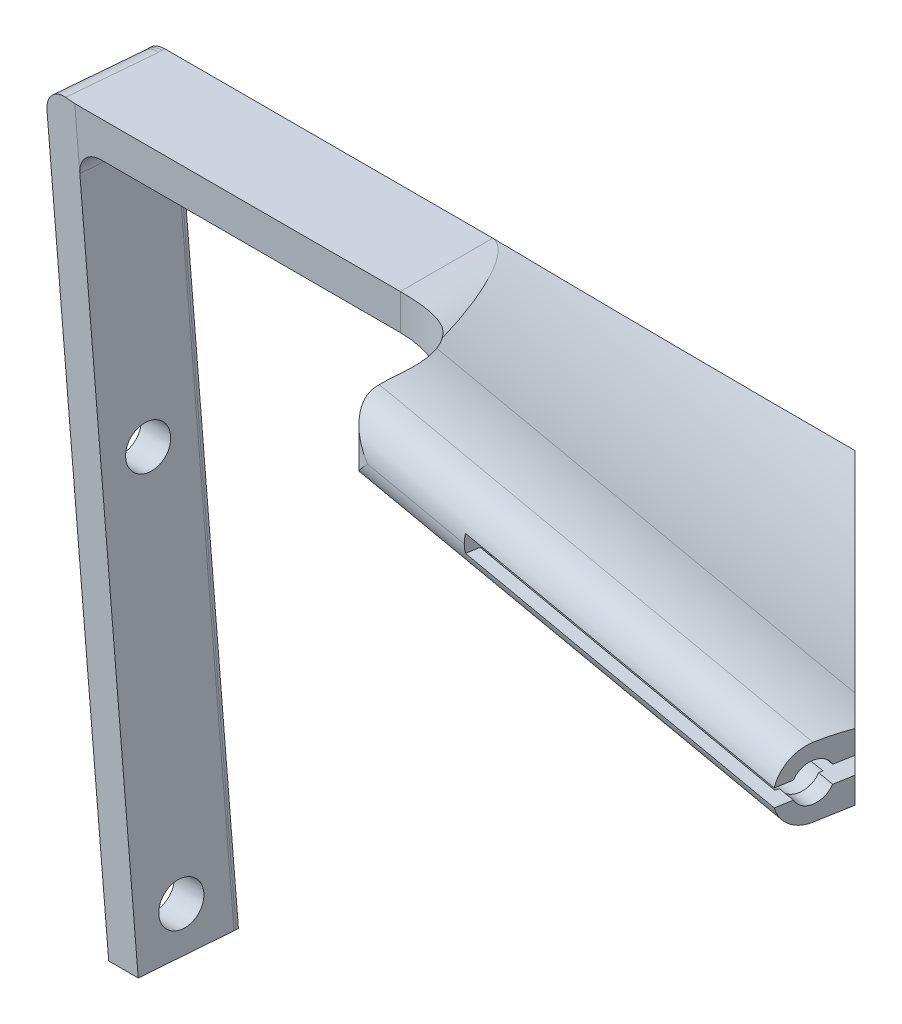
from build123d import *

# Parameters (mm, degrees)
OVERALLGEOMETRY_BOSS_EXTRUDE1_DEPTH = 0.254
CAMERAPITCH_BOSS_EXTRUDE2_DEPTH     = 56.109378
BOSS_EXTRUDE3_DEPTH                 = 5.08
SKETCH3_R                           = 1.524
CUT_EXTRUDE1_DEPTH                  = 97.064287471
CUT_EXTRUDE2_DEPTH                  = 27.94
BOSS_EXTRUDE4_DEPTH                 = 1.27
CUT_EXTRUDE4_DEPTH                  = 95.187753464
CUT_EXTRUDE5_DEPTH                  = 98.850191818
FILLET1_R                           = 2.54
FILLET2_R                           = 7.62
SKETCH10_R                          = 51.133924518
CUT_EXTRUDE6_DEPTH                  = 95.075440862
FILLET3_R                           = 2.54
FILLET4_R                           = 17.78
CUT_EXTRUDE8_DEPTH                  = 94.555694116
CUT_EXTRUDE8_DEPTH_BACK             = 94.555694116
FILLET14_R                          = 1.524
FILLET15_R                          = 1.524
FILLET16_R                          = 1.524
FILLET17_R                          = 1.524


with BuildPart() as part:
    # Sketch1 → OverallGeometry-Boss-Extrude1 (new body)
    with BuildSketch(Plane.XY):
        Polygon((0, 0), (76.2, 0), (76.2, -5.08), (2.853610021, -5.08), (7.281121752, -55.686690663), (4.890254477, -55.895864446), align=None)
    extrude(amount=OVERALLGEOMETRY_BOSS_EXTRUDE1_DEPTH)

    # Sketch2 → CameraPitch-Boss-Extrude2 (add)
    with BuildSketch(Plane(origin=(4.890254477, -55.895864446, 0), x_dir=(0.9961946980917449, 0.08715574274766635, 0), z_dir=(0.08715574274766635, -0.9961946980917449, 0))):
        Polygon((2.4, 0.254), (1.828330337, 6.788214146), (-0.553438966, 6.579836333), (0, 0.254), align=None)
    extrude(amount=-CAMERAPITCH_BOSS_EXTRUDE2_DEPTH)

    # Sketch4 → Boss-Extrude3 (add)
    with BuildSketch(Plane.XZ.offset(5.08)):
        Polygon((76.2, 0.254), (71.789336287, 25.268116927), (33.571372988, 18.529258849), (33.571372988, 6.788214146), (-1.988627012, 6.788214146), (-1.419132725, 0.254), (-1.419132725, 0), (76.2, 0), align=None)
    extrude(amount=-BOSS_EXTRUDE3_DEPTH)

    # Sketch3 → Cut-Extrude1 (cut, through all)
    with BuildSketch(Plane(origin=(2.394675351, 0.209506946, 0.210307229), x_dir=(0.1097410378717943, -0.30459177963520256, -0.9461399222025683), z_dir=(0.9924038765061031, 0.08682408883347341, 0.08715574274766112))):
        with Locations(Location((4.583283833, -24.85972329, 0), (0, 0, 17.803073687))):
            Circle(SKETCH3_R)
        with Locations(Location((13.32842777, -51.395850692, 0), (0, 0, 17.803073687))):
            Circle(SKETCH3_R)
    extrude(amount=-CUT_EXTRUDE1_DEPTH, mode=Mode.SUBTRACT)

    # Sketch5 → Cut-Extrude2 (cut)
    with BuildSketch(Plane(origin=(73.94572541, 0, 13.038626498), x_dir=(0.1736481776669353, 0, -0.9848077530122074), z_dir=(0.9848077530122074, 0, 0.1736481776669353))):
        with BuildLine():
            Line((-12.418150031, -1.905), (-11.402150031, -1.905))
            ThreePointArc((-11.402150031, -1.905), (-9.878150031, -0.889), (-8.354150031, -1.905))
            Line((-8.354150031, -1.905), (-4.544150031, -1.905))
            Line((-4.544150031, -1.905), (-4.544150031, -3.175))
            Line((-4.544150031, -3.175), (-8.354150031, -3.175))
            ThreePointArc((-8.354150031, -3.175), (-9.878150031, -4.191), (-11.402150031, -3.175))
            Line((-11.402150031, -3.175), (-12.418150031, -3.175))
            Line((-12.418150031, -3.175), (-12.418150031, -1.905))
        make_face()
    extrude(amount=-CUT_EXTRUDE2_DEPTH, mode=Mode.SUBTRACT)

    # Sketch6 → Boss-Extrude4 (add)
    with BuildSketch(Plane(origin=(73.94572541, 0, 13.038626498), x_dir=(0.1736481776669353, 0, -0.9848077530122074), z_dir=(0.9848077530122074, 0, 0.1736481776669353))):
        with BuildLine():
            Line((-11.402150031, -1.905), (-11.12249082, -1.905))
            ThreePointArc((-11.12249082, -1.905), (-9.878150031, -1.143), (-8.633809242, -1.905))
            Line((-8.633809242, -1.905), (-8.354150031, -1.905))
            ThreePointArc((-8.354150031, -1.905), (-9.878150031, -0.889), (-11.402150031, -1.905))
        make_face()
        with BuildLine():
            Line((-8.354150031, -3.175), (-8.633809242, -3.175))
            ThreePointArc((-8.633809242, -3.175), (-9.878150031, -3.937), (-11.12249082, -3.175))
            Line((-11.12249082, -3.175), (-11.402150031, -3.175))
            ThreePointArc((-11.402150031, -3.175), (-9.878150031, -4.191), (-8.354150031, -3.175))
        make_face()
    extrude(amount=-BOSS_EXTRUDE4_DEPTH)

    # Sketch8 → Cut-Extrude4 (cut, through all)
    with BuildSketch(Plane(origin=(4.890254477, -55.895864446, 0), x_dir=(0.9961946980917449, 0.08715574274766635, 0), z_dir=(0.08715574274766635, -0.9961946980917449, 0))):
        Polygon((1.828330337, 6.788214146), (-0.553438966, 6.579836333), (0, 0.254), (0, 0), (-7.348278785, 0), (-7.348278785, 6.788214146), align=None)
    extrude(amount=-CUT_EXTRUDE4_DEPTH, mode=Mode.SUBTRACT)

    # Sketch9 → Cut-Extrude5 (cut, through all)
    with BuildSketch(Plane(origin=(0, 0, 0), x_dir=(1, 0, 0), z_dir=(0, 1, 0))):
        Polygon((72.693522348, -20.140222957), (52.553299392, 0), (76.2, 0), (76.2, -20.140222957), align=None)
    extrude(amount=-CUT_EXTRUDE5_DEPTH, mode=Mode.SUBTRACT)

    # Fillet1
    fillet1_edges = [part.edges().sort_by_distance(p)[0] for p in [
        (33.571372988, -2.54, 18.529258849),
    ]]
    fillet(fillet1_edges, radius=FILLET1_R)

    # Fillet2
    fillet2_edges = [part.edges().sort_by_distance(p)[0] for p in [
        (33.571372988, -2.54, 6.788214146),
    ]]
    fillet(fillet2_edges, radius=FILLET2_R)

    # Sketch10 → Cut-Extrude6 (cut, through all)
    with BuildSketch(Plane(origin=(73.94572541, 0, 13.038626498), x_dir=(0.1736481776669353, 0, -0.9848077530122074), z_dir=(0.9848077530122074, 0, 0.1736481776669353))):
        with Locations((9.12578467, 48.453924518)):
            Circle(SKETCH10_R)
    extrude(amount=-CUT_EXTRUDE6_DEPTH, mode=Mode.SUBTRACT)

    # Fillet3
    # the kernel refuses this fillet: 2.54 mm, written as the material it takes off along each edge
    with BuildSketch(Plane(origin=(78.042865519, 0, 26.370782855), x_dir=(0, -1, 0), z_dir=(-0.9848077530122074, 0, -0.17364817766693483)), Plane(origin=(78.042865519, -5.08, 26.370782855), x_dir=(0.1736481776669348, 0, -0.9848077530122072), z_dir=(-0.9848077530122074, 0, -0.17364817766693483))) as fillet3_piece_1:
        with BuildLine():
            CenterArc((FILLET3_R, -FILLET3_R), FILLET3_R, 90, 90)
            Line((0, -FILLET3_R), (0, 0))
            Line((0, 0), (FILLET3_R, 0))
        make_face()
    extrude(amount=49.376223923, mode=Mode.SUBTRACT)

    # Fillet4
    # the kernel refuses this fillet: 17.78 mm, written as the material it takes off along each edge
    with BuildSketch(Plane(origin=(26.924174105, 0, 12.069851972), x_dir=(-0.17364817766672255, -1.565211462132439e-06, 0.9848077530110009), z_dir=(0.9848077530122074, 0, 0.1736481776669353))) as fillet4_piece_1:
        with BuildLine():
            CenterArc((2.69463399, 17.779970779), FILLET4_R, 253.968520973, 15.92760212)
            Line((-2.215587596, 0.691432984), (-2.706609755, -1.017420796))
            ThreePointArc((-2.706609755, -1.017420796), (-1.633548438, -1.338981063), (-0.568061322, -1.684811662))
            Line((-0.568061322, -1.684811662), (-2.783e-06, -1.778))
            ThreePointArc((-2.783e-06, -1.778), (2.666997217, -1.778004174), (2.659175472, -1.777997078))
            Line((2.659175472, -1.777997078), (2.662398973, 0))
        make_face()
    extrude(amount=53.131411648, mode=Mode.SUBTRACT)

    # Sketch13 → Cut-Extrude8 (cut, two sides: drawn at the far end of the back side and taken through both)
    with BuildSketch(Plane.XY.offset(6.788214146).offset(-CUT_EXTRUDE8_DEPTH_BACK)):
        with BuildLine():
            Line((-24.848627012, 22.929081842), (25.951372988, 22.929081842))
            ThreePointArc((25.951372988, 22.929081842), (38.651372988, 10.229081842), (25.951372988, -2.470918158))
            Line((25.951372988, -2.470918158), (-24.848627012, -2.470918158))
            ThreePointArc((-24.848627012, -2.470918158), (-37.548627012, 10.229081842), (-24.848627012, 22.929081842))
        make_face()
    extrude(amount=CUT_EXTRUDE8_DEPTH + CUT_EXTRUDE8_DEPTH_BACK, mode=Mode.SUBTRACT)

    # Fillet14
    # the kernel refuses this fillet: 1.524 mm, written as the material it takes off along each edge
    with BuildSketch(Plane(origin=(2.839111821, -4.914284813, 0.254), x_dir=(0, 0, -1), z_dir=(0.08715574274766345, -0.9961946980917451, 0))) as fillet14_piece_1_section:
        with BuildLine():
            CenterArc((FILLET14_R * 0.0436609429085, -FILLET14_R), FILLET14_R, 90, 5)
            Line((-FILLET14_R * 0.0434947998391, -FILLET14_R * 0.00380530190825), (0, 0))
            Line((0, 0), (FILLET14_R * 0.0436609429085, 0))
        make_face()
    fillet14_piece_1 = extrude(amount=51.132696385, mode=Mode.PRIVATE)
    fillet14_piece_1 = split(fillet14_piece_1, bisect_by=Plane(origin=(5.088209077, -5.08, 0.254593638), z_dir=(0, -1, 0)), keep=Keep.TOP, mode=Mode.PRIVATE)
    add(fillet14_piece_1, mode=Mode.SUBTRACT)

    # Fillet15
    fillet15_edges = [part.edges().sort_by_distance(p)[0] for p in [
        (2.563772631, -5.08, 3.554250111),
        (2.853610021, -5.08, 0.093730362),
        (2.852153949, -5.08, 0.253937152),
    ]]
    fillet(fillet15_edges, radius=FILLET15_R)

    # Fillet16
    # the kernel refuses this fillet: 1.524 mm, written as the material it adds along each edge
    with BuildSketch(Plane(origin=(4.890254477, -55.895864446, 0.254), x_dir=(0, 0, -1), z_dir=(-0.08715574274766158, 0.9961946980917453, 0))) as fillet16_piece_1:
        with BuildLine():
            CenterArc((FILLET16_R * 0.0436609429085, FILLET16_R), FILLET16_R, 265, 5)
            Line((-FILLET16_R * 0.0434947998391, FILLET16_R * 0.00380530190826), (0, 0))
            Line((0, 0), (FILLET16_R * 0.0436609429085, 0))
        make_face()
    extrude(amount=51.009972792)
    with BuildSketch(Plane(origin=(0.444442411, -5.08, 0.254), x_dir=(-0.08682408883346991, -0.007596123493897102, 0.9961946980917452), z_dir=(-0.08715574274766635, 0.9961946980917449, 0))) as fillet16_piece_2_section:
        with BuildLine():
            CenterArc((FILLET16_R * 0.043660942909, -FILLET16_R), FILLET16_R, 90, 5)
            Line((-FILLET16_R * 0.0434947998397, -FILLET16_R * 0.00380530190835), (0, 0))
            Line((0, 0), (FILLET16_R * 0.043660942909, 0))
        make_face()
    fillet16_piece_2 = extrude(amount=2.785396303, mode=Mode.PRIVATE)
    fillet16_piece_2 = split(fillet16_piece_2, bisect_by=Plane(origin=(0.343901327, -2.470918158, 0.25459558), z_dir=(0, -1, 0)), keep=Keep.TOP, mode=Mode.PRIVATE)
    add(fillet16_piece_2)

    # Fillet17
    fillet17_edges = [part.edges().sort_by_distance(p)[0] for p in [
        (0.216177327, -2.470918158, 0.093730362),
        (0.214721255, -2.470918158, 0.253937152),
        (-0.064509896, -2.470918158, 3.450061204),
    ]]
    fillet(fillet17_edges, radius=FILLET17_R)


solid = part.part
